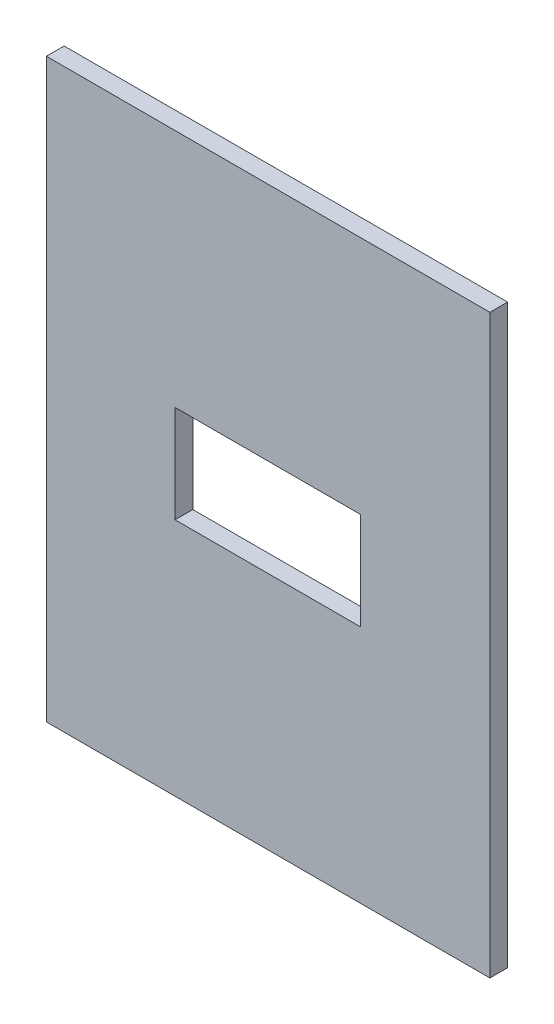
from build123d import *

# Parameters (mm, degrees)
SKETCH1_W           = 100
SKETCH1_H           = 130
BOSS_EXTRUDE1_DEPTH = 4
SKETCH3_W           = 41.841902152
SKETCH3_H           = 21.943308285
CUT_EXTRUDE2_DEPTH  = 10


with BuildPart() as part:
    # Sketch1 → Boss-Extrude1 (new body)
    with BuildSketch(Plane.XY):
        with Locations((50, 65)):
            Rectangle(SKETCH1_W, SKETCH1_H)
    extrude(amount=BOSS_EXTRUDE1_DEPTH)

    # Sketch3 → Cut-Extrude2 (cut)
    with BuildSketch(Plane.XY.offset(4)):
        with Locations((49.934412193, 64.958629487)):
            Rectangle(SKETCH3_W, SKETCH3_H)
    extrude(amount=-CUT_EXTRUDE2_DEPTH, mode=Mode.SUBTRACT)


solid = part.part
